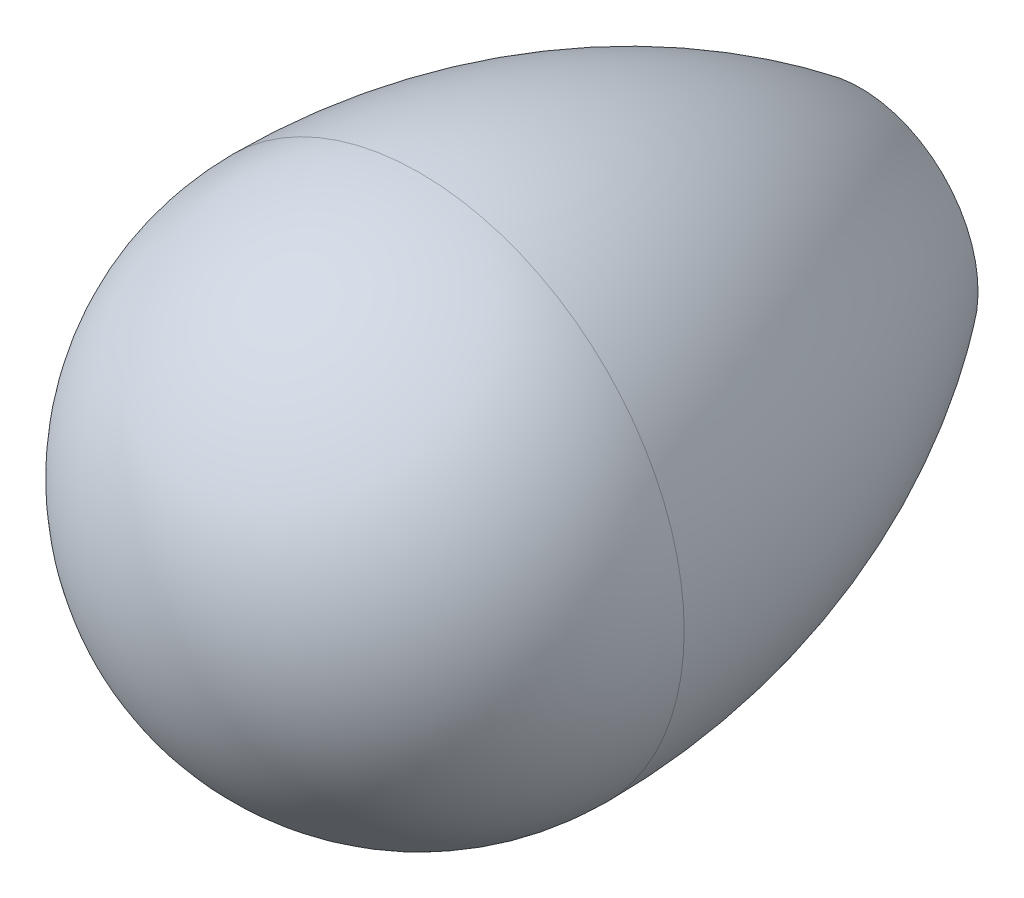
from build123d import *

# Parameters (mm, degrees)
BOSS_EXTRUDE3_REACH = 45.126
SKETCH10_R          = 4.7625
SKETCH10_R_2        = 3.96875
SKETCH5_R           = 3.96875
BOSS_EXTRUDE1_DEPTH = 12.7
SKETCH6_R           = 3.96875
BOSS_EXTRUDE2_DEPTH = 12.7
CUT_SWEEP1_PITCH    = 1.411111111
CUT_SWEEP1_TO       = 12.7


with BuildPart() as part:
    # Sketch3 → Revolve1 (revolve)
    with BuildSketch(Plane(origin=(0, 0, 0), x_dir=(0, 0, -1), z_dir=(1, 0, 0)), mode=Mode.PRIVATE) as revolve1_sk:
        with BuildLine():
            Line((6.35, 3.96875), (6.35, 0))
            Line((6.35, 0), (-19.05, 0))
            ThreePointArc((-19.05, 0), (-14.865288136, 10.102788136), (-4.7625, 14.2875))
            ThreePointArc((-4.7625, 14.2875), (7.787789464, 12.250868391), (19.05, 6.35))
            Line((19.05, 6.35), (19.05, 4.7625))
            Line((19.05, 4.7625), (6.35, 4.7625))
            Line((6.35, 4.7625), (6.35, 3.96875))
        make_face()
    revolve(revolve1_sk.sketch.rotate(Axis((0, 0, 19.05), (0, 0, -1)), 180), axis=Axis((0, 0, 19.05), (0, 0, -1)))


with BuildPart() as body_2:

    # Sketch10 → Boss-Extrude3 (new, up to next)
    with BuildSketch(Plane(origin=(0, 0, -19.05), x_dir=(-1, 0, 0), z_dir=(0, 0, -1)), mode=Mode.PRIVATE) as boss_extrude3_sk1:
        with Locations(Location((0, 0, 0), (0, 0, 270))):
            Circle(SKETCH10_R)
        with Locations(Location((0, 0, 0), (0, 0, 90))):
            Circle(SKETCH10_R_2, mode=Mode.SUBTRACT)
    boss_extrude3_tool1 = extrude(boss_extrude3_sk1.sketch, amount=-BOSS_EXTRUDE3_REACH, mode=Mode.PRIVATE) - part.part
    add(boss_extrude3_tool1.solids().sort_by_distance((0, 4.627796, -19.05))[0])

    # Sketch6 → Boss-Extrude2 (add)
    with BuildSketch(Plane(origin=(0, 0, -19.05), x_dir=(-1, 0, 0), z_dir=(0, 0, -1))):
        with Locations(Location((0, 0, 0), (0, 0, 90))):
            Circle(SKETCH6_R)
    extrude(amount=-BOSS_EXTRUDE2_DEPTH)


with BuildPart() as body_3:
    # Sketch5 → Boss-Extrude1 (new body)
    with BuildSketch(Plane(origin=(0, 0, -19.05), x_dir=(-1, 0, 0), z_dir=(0, 0, -1))):
        with Locations(Location((0, 0, 0), (0, 0, 90))):
            Circle(SKETCH5_R)
    extrude(amount=-BOSS_EXTRUDE1_DEPTH)

    # Cut-Sweep1: arcs per turn and ends read off the stored shape
    # Cut-Sweep1: the profile of Sketch8 profile screwed along a right-hand helix through 10 turns, 8 arcs to a turn; built about Z, then put on its axis
    cut_sweep1_z = Axis((0, 0, 0), (0, 0, 1))
    cut_sweep1_corners = [(3.96905, 4.156e-06, -0.352604338), (3.052206448, 3.196e-06, -0.881944209), (3.052206448, 3.196e-06, -1.058333098), (3.96905, 4.156e-06, -1.58767297)]
    with BuildLine(mode=Mode.PRIVATE) as cut_sweep1_profile:
        Line(cut_sweep1_corners[0], cut_sweep1_corners[1])
        Line(cut_sweep1_corners[1], cut_sweep1_corners[2])
        Line(cut_sweep1_corners[2], cut_sweep1_corners[3])
        Line(cut_sweep1_corners[3], cut_sweep1_corners[0])
    cut_sweep1_cap = Face(cut_sweep1_profile.wire())
    cut_sweep1_turn_angles = [0, 22.5, 45, 67.5, 90, 112.5, 135, 157.5, 180, 202.5, 225, 247.5, 270, 292.5, 315, 337.5, 360]
    cut_sweep1_turn_weights = [1, 0.9238795325112867, 1, 0.9238795325112867, 1, 0.9238795325112867, 1, 0.9238795325112867, 1, 0.9238795325112867, 1, 0.9238795325112867, 1, 0.9238795325112867, 1, 0.9238795325112867, 1]
    cut_sweep1_turn_rails = [Edge.make_bspline([Vector(p[0], p[1], 0).rotate(cut_sweep1_z, cut_sweep1_turn_angles[k]) / cut_sweep1_turn_weights[k] + Vector(0, 0, p[2] + CUT_SWEEP1_PITCH * cut_sweep1_turn_angles[k] / 360) for k in range(17)], [0, 0, 0, 1, 1, 2, 2, 3, 3, 4, 4, 5, 5, 6, 6, 7, 7, 8, 8, 8], 2, cut_sweep1_turn_weights) for p in cut_sweep1_corners]
    cut_sweep1_turn_sides = [Face.make_surface_from_curves(cut_sweep1_turn_rails[p[0]], cut_sweep1_turn_rails[p[1]]) for p in [(0, 1), (1, 2), (2, 3), (3, 0)]]
    cut_sweep1 = Plane(origin=(0, 0, -19.05), x_dir=(1, 0, 0), z_dir=(0, 0, 1)) * split(Solid(Shell([*[p.moved(Location((0, 0, CUT_SWEEP1_PITCH * i))) for i in range(10) for p in cut_sweep1_turn_sides], cut_sweep1_cap, cut_sweep1_cap.rotate(cut_sweep1_z, 3600).moved(Location((0, 0, CUT_SWEEP1_PITCH * 3600 / 360)))])), bisect_by=Plane.XY.offset(CUT_SWEEP1_TO), keep=Keep.BOTTOM, mode=Mode.PRIVATE)
    add(cut_sweep1, mode=Mode.SUBTRACT)


with BuildPart() as body_2_1:
    add(body_2.part)

    # Combine1: cut body 3
    add(body_3.part, mode=Mode.SUBTRACT)

    # Cut-Extrude1 cone 1 section (through the dimple's axis) → Cut-Extrude1 (revolve, cut)
    with BuildSketch(Plane(origin=(0, 0, -19.05), x_dir=(0, 1, 0), z_dir=(1, 0, 0))):
        Polygon((0, 0), (3.96875, 0), (0, 3.96875), align=None)
    revolve(axis=Axis((0, 0, -19.05), (0, 0, 1)), mode=Mode.SUBTRACT)


solid = Compound([part.part, body_2_1.part])
